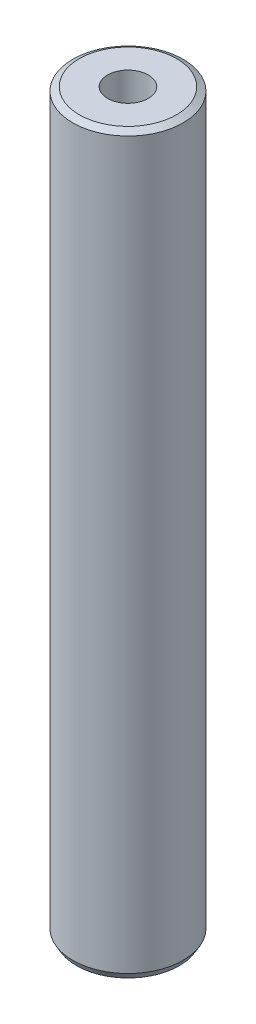
from build123d import *
from OCP.BRepFilletAPI import BRepFilletAPI_MakeChamfer

# Parameters (mm, degrees)
SKETCH1_R           = 45
BOSS_EXTRUDE1_DEPTH = 600
SKETCH2_R           = 16.619119031
CUT_EXTRUDE1_DEPTH  = 604.365560834
CHAMFER1_SIZE       = 3.072766985
CHAMFER1_SIZE2      = 5.322188538


with BuildPart() as part:
    # Sketch1 → Boss-Extrude1 (new body)
    with BuildSketch(Plane(origin=(0, 0, 0), x_dir=(1, 0, 0), z_dir=(0, 1, 0))):
        Circle(SKETCH1_R)
    extrude(amount=BOSS_EXTRUDE1_DEPTH)

    # Sketch2 → Cut-Extrude1 (cut, through all)
    with BuildSketch(Plane(origin=(0, 0, 0), x_dir=(1, 0, 0), z_dir=(0, 1, 0))):
        Circle(SKETCH2_R)
    extrude(amount=CUT_EXTRUDE1_DEPTH, mode=Mode.SUBTRACT)

    # Chamfer1: one chamfer whose edges measure the first distance from different faces: ONE call of the kernel's chamfer builder (chamfer() names one face for all edges)
    chamfer1_edges_1 = [part.edges().sort_by_distance(p)[0] for p in [
        (-45, 600, 0),
    ]]
    chamfer1_side_1 = [part.faces().sort_by_distance(p)[0] for p in [
        (-45, 300, 0),
    ]]
    chamfer1_edges_2 = [part.edges().sort_by_distance(p)[0] for p in [
        (-45, 0, 0),
    ]]
    chamfer1_side_2 = [part.faces().sort_by_distance(p)[0] for p in [
        (-43.727207794, 0, 0),
    ]]
    chamfer1 = BRepFilletAPI_MakeChamfer(part.part.solid().wrapped)
    for e in chamfer1_edges_1:
        chamfer1.Add(CHAMFER1_SIZE, CHAMFER1_SIZE2, e.wrapped, chamfer1_side_1[0].wrapped)  # the first distance lies on this face
    for e in chamfer1_edges_2:
        chamfer1.Add(CHAMFER1_SIZE, CHAMFER1_SIZE2, e.wrapped, chamfer1_side_2[0].wrapped)  # the first distance lies on this face
    add(Compound.cast(chamfer1.Shape()), mode=Mode.REPLACE)


solid = part.part
